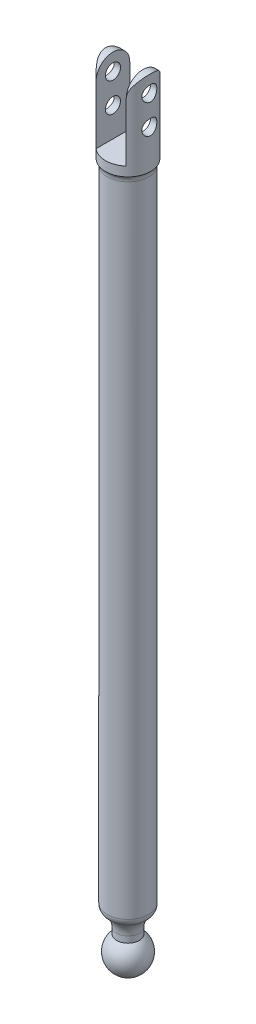
from build123d import *

# Parameters (mm, degrees)
ESBO_O2_R                         = 6
RESSALTO_EXTRUS_O1_DEPTH          = 20
ESBO_O3_R                         = 11
RESSALTO_EXTRUS_O2_DEPTH          = 350
FILETE1_R                         = 10
FILETE2_R                         = 5
RESSALTO_EXTRUS_O3_DEPTH          = 40
RESSALTO_EXTRUS_O4_START          = -5
ESBO_O7_R                         = 12
RESSALTO_EXTRUS_O4_DEPTH          = 5
FILETE3_R                         = 5
CORTE_EXTRUS_O1_DEPTH             = 17.5
CORTE_EXTRUS_O2_REACH             = 412.663
ESBO_O10_R                        = 4
CORTE_EXTRUS_O2_DIRECTION_2_REACH = 412.663


with BuildPart() as part:
    # Esboço1 → Revolução1 (revolve)
    with BuildSketch(Plane.XY):
        with BuildLine():
            Line((-10, 0), (10, 0))
            ThreePointArc((10, 0), (0, 10), (-10, 0))
        make_face()
    revolve(axis=Axis((-10, 0, 0), (1, 0, 0)))

    # Esboço2 → Ressalto-extrusão1 (add)
    with BuildSketch(Plane(origin=(0, 0, 0), x_dir=(1, 0, 0), z_dir=(0, 1, 0))):
        with Locations(Location((0, 0, 0), (0, 0, 90))):
            Circle(ESBO_O2_R)
    extrude(amount=RESSALTO_EXTRUS_O1_DEPTH)

    # Esboço3 → Ressalto-extrusão2 (add)
    with BuildSketch(Plane(origin=(0, 20, 0), x_dir=(1, 0, 0), z_dir=(0, 1, 0))):
        with Locations(Location((0, 0, 0), (0, 0, 270))):
            Circle(ESBO_O3_R)
    extrude(amount=RESSALTO_EXTRUS_O2_DEPTH)

    # Filete1
    # the kernel refuses this fillet: 10 mm, written as the material it adds along each edge
    with BuildSketch(Plane(origin=(0, 20, 0), x_dir=(0, 0, -1), z_dir=(1, 0, 0))) as filete1_piece_1:
        with BuildLine():
            CenterArc((16, -8.660254038), FILETE1_R, 120, 60)
            Line((6, -8.660254038), (5.8, -8.660254038))
            Line((5.8, -8.660254038), (5.8, 0))
            Line((5.8, 0), (6, 0.2))
            ThreePointArc((6, 0.2), (8.5, 0.2), (10.9, 0.173205081))
            Line((10.9, 0.173205081), (11, 0))
        make_face()
    revolve(axis=Axis((0, 20, 0), (0, 1, 0)))

    # Filete2
    filete2_edges = [part.edges().sort_by_distance(p)[0] for p in [
        (11, 20, 0),
    ]]
    fillet(filete2_edges, radius=FILETE2_R)

    # Esboço5 → Ressalto-extrusão3 (add)
    with BuildSketch(Plane(origin=(0, 370, 0), x_dir=(1, 0, 0), z_dir=(0, 1, 0))):
        with BuildLine():
            Line((-8, -8.94427191), (-8, 8.94427191))
            ThreePointArc((-8, 8.94427191), (-12, 0), (-8, -8.94427191))
        make_face()
        with BuildLine():
            Line((8, -8.94427191), (8, 8.94427191))
            ThreePointArc((8, 8.94427191), (12, 0), (8, -8.94427191))
        make_face()
    extrude(amount=RESSALTO_EXTRUS_O3_DEPTH)

    # Esboço7 → Ressalto-extrusão4 (add)
    with BuildSketch(Plane(origin=(0, 370, 0), x_dir=(1, 0, 0), z_dir=(0, 1, 0)).offset(RESSALTO_EXTRUS_O4_START)):
        with Locations(Location((0, 0, 0), (0, 0, 131.810314896))):
            Circle(ESBO_O7_R)
    extrude(amount=RESSALTO_EXTRUS_O4_DEPTH)

    # Filete3
    # the kernel refuses this fillet: 5 mm, written as the material it adds along each edge
    with BuildSketch(Plane(origin=(0, 365, 0), x_dir=(0, 0, 1), z_dir=(1, 0, 0))) as filete3_piece_1:
        with BuildLine():
            CenterArc((16, 3), FILETE3_R, 180, 36.869897646)
            Line((12, 0), (11.92, -0.06))
            ThreePointArc((11.92, -0.06), (11.5, -0.1), (11, -0.1))
            Line((11, -0.1), (10.9, 0))
            Line((10.9, 0), (10.9, 3))
            Line((10.9, 3), (11, 3))
        make_face()
    revolve(axis=Axis((0, 365, 0), (0, -1, 0)))

    # Esboço9 → Corte-extrusão1 (cut, symmetric)
    with BuildSketch(Plane(origin=(0, 0, 0), x_dir=(0, 0, -1), z_dir=(1, 0, 0))):
        with BuildLine():
            Line((-8.94427191, 410), (-8.94427191, 401.05572809))
            ThreePointArc((-8.94427191, 401.05572809), (-6.32455539, 407.38028334), (-1.98e-07, 410))
            Line((-1.98e-07, 410), (-8.94427191, 410))
        make_face()
        with BuildLine():
            Line((8.94427191, 410), (-1.98e-07, 410))
            ThreePointArc((-1.98e-07, 410), (6.32455525, 407.38028348), (8.94427191, 401.05572809))
            Line((8.94427191, 401.05572809), (8.94427191, 410))
        make_face()
    extrude(amount=CORTE_EXTRUS_O1_DEPTH, both=True, mode=Mode.SUBTRACT)

    # Esboço10 → Corte-extrusão2 (cut, up to next)
    with BuildSketch(Plane.ZY.offset(-8), mode=Mode.PRIVATE) as corte_extrus_o2_sk1:
        with Locations((0, 385.527864045)):
            Circle(ESBO_O10_R)
    corte_extrus_o2_tool1 = extrude(corte_extrus_o2_sk1.sketch, amount=-CORTE_EXTRUS_O2_REACH, mode=Mode.PRIVATE) & part.part
    # Esboço10 → Corte-extrusão2 (cut, up to next)
    with BuildSketch(Plane.ZY.offset(-8), mode=Mode.PRIVATE) as corte_extrus_o2_sk2:
        with Locations((0, 401.05572809)):
            Circle(ESBO_O10_R)
    corte_extrus_o2_tool2 = extrude(corte_extrus_o2_sk2.sketch, amount=-CORTE_EXTRUS_O2_REACH, mode=Mode.PRIVATE) & part.part
    add(corte_extrus_o2_tool1.solids().sort_by_distance((8, 385.527864, 0))[0], mode=Mode.SUBTRACT)
    add(corte_extrus_o2_tool2.solids().sort_by_distance((8, 401.055728, 0))[0], mode=Mode.SUBTRACT)

    # Esboço10 → Corte-extrusão2 direction 2 (cut, up to next)
    with BuildSketch(Plane.ZY.offset(-8), mode=Mode.PRIVATE) as corte_extrus_o2_direction_2_sk1:
        with Locations((0, 385.527864045)):
            Circle(ESBO_O10_R)
    corte_extrus_o2_direction_2_tool1 = extrude(corte_extrus_o2_direction_2_sk1.sketch, amount=CORTE_EXTRUS_O2_DIRECTION_2_REACH, mode=Mode.PRIVATE) & part.part
    # Esboço10 → Corte-extrusão2 direction 2 (cut, up to next)
    with BuildSketch(Plane.ZY.offset(-8), mode=Mode.PRIVATE) as corte_extrus_o2_direction_2_sk2:
        with Locations((0, 401.05572809)):
            Circle(ESBO_O10_R)
    corte_extrus_o2_direction_2_tool2 = extrude(corte_extrus_o2_direction_2_sk2.sketch, amount=CORTE_EXTRUS_O2_DIRECTION_2_REACH, mode=Mode.PRIVATE) & part.part
    add(corte_extrus_o2_direction_2_tool1.solids().sort_by_distance((8, 385.527864, 0))[0], mode=Mode.SUBTRACT)
    add(corte_extrus_o2_direction_2_tool2.solids().sort_by_distance((8, 401.055728, 0))[0], mode=Mode.SUBTRACT)


solid = part.part
